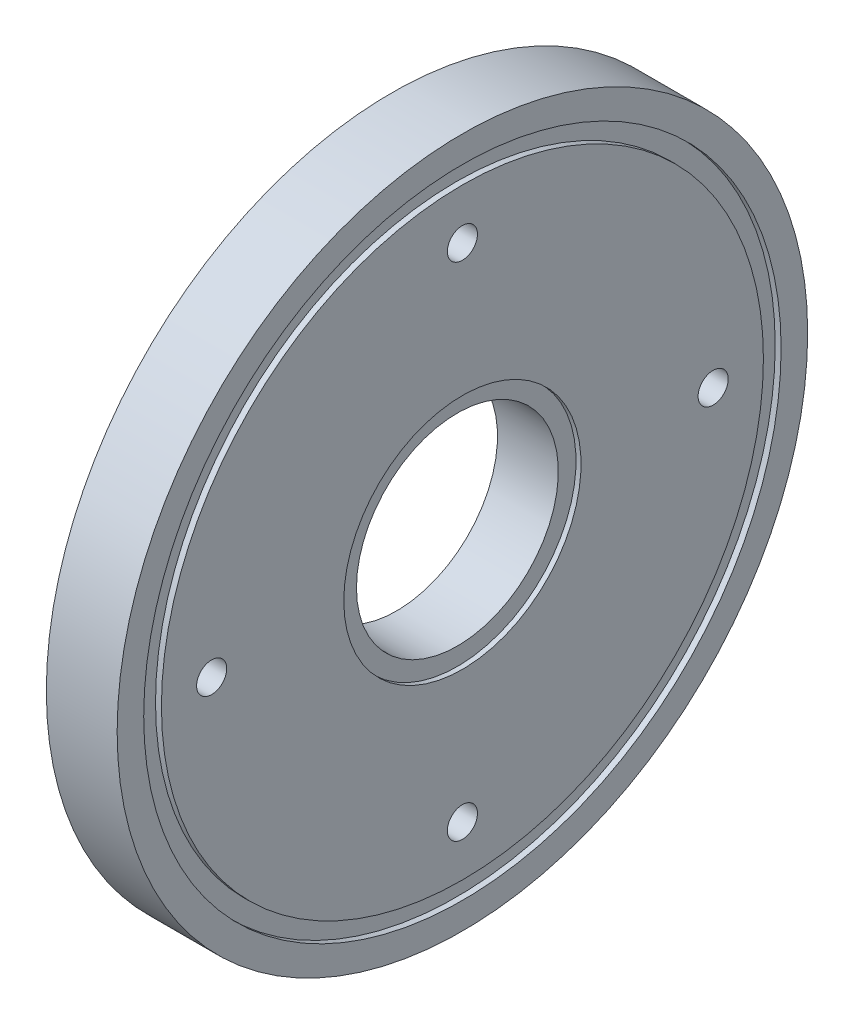
from build123d import *

# Parameters (mm, degrees)
M3_CLEARANCE_HOLE1_D     = 3.4
M3_CLEARANCE_HOLE1_DEPTH = 8
M3_CLEARANCE_HOLE1_TIP   = 1.021463052


with BuildPart() as part:
    # Sketch1 → Revolve17 (revolve)
    with BuildSketch(Plane.XY):
        Polygon((20.481671209, 13.4), (21.047671209, 13.4), (21.047671209, 34), (20.380671209, 34), (20.380671209, 36), (21.047671209, 36), (21.047671209, 39), (13.047671209, 39), (13.047671209, 36), (13.714671209, 36), (13.714671209, 34), (13.047671209, 34), (13.047671209, 13.4), (13.613671209, 13.4), (13.613671209, 11.4), (18.481671209, 11.4), (20.481671209, 11.4), align=None)
    revolve(axis=Axis((-801.920554309, 0, 0), (1, 0, 0)))

    # M3 Clearance Hole1
    with Locations(Plane.ZY.offset(-13.047671209)):
        with Locations((0, -28.325), (0, 28.325), (28.325, 0), (-28.325, 0)):
            Hole(M3_CLEARANCE_HOLE1_D / 2, depth=M3_CLEARANCE_HOLE1_DEPTH)
            with Locations((0, 0, -(M3_CLEARANCE_HOLE1_DEPTH + M3_CLEARANCE_HOLE1_TIP / 2))):  # 118° drill point
                Cone(0, M3_CLEARANCE_HOLE1_D / 2, M3_CLEARANCE_HOLE1_TIP, mode=Mode.SUBTRACT)


solid = part.part
